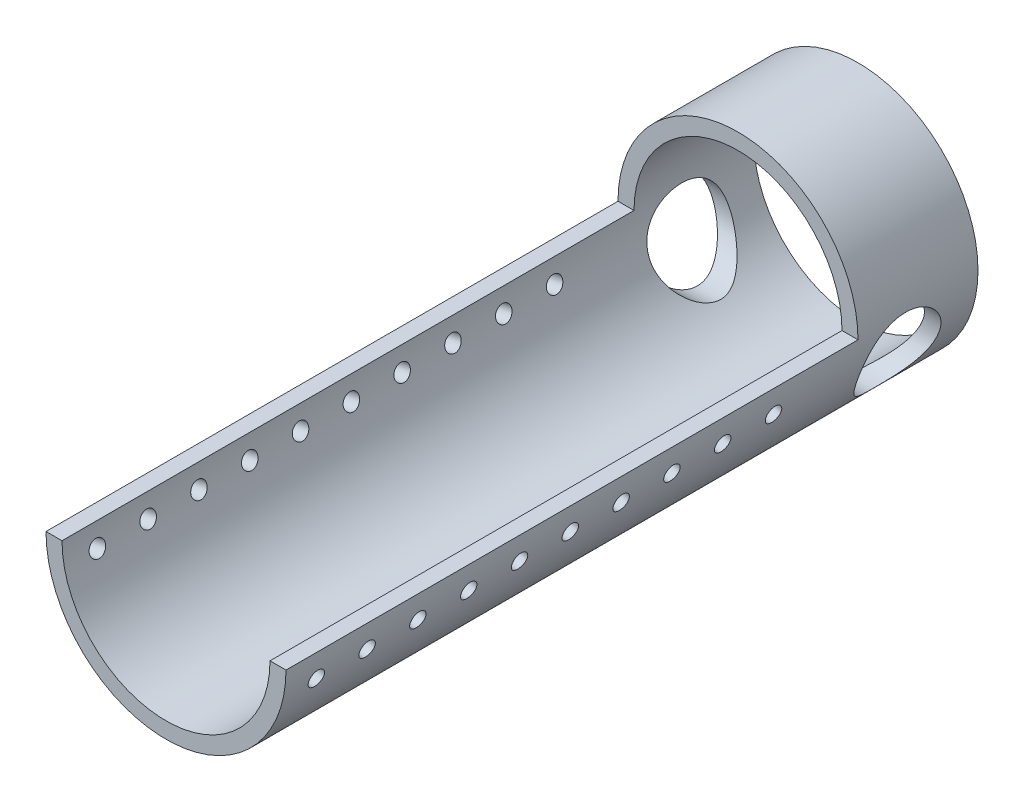
from build123d import *

# Parameters (mm, degrees)
SKETCH1_R               = 30
SKETCH1_R_2             = 26
BOSS_EXTRUDE1_DEPTH     = 86.5
SKETCH3_W               = 60
SKETCH3_H               = 30
CUT_EXTRUDE1_DEPTH      = 143
F_10_32_TAPPED_HOLE2_D  = 4.0386
LPATTERN2_COUNT         = 10
LPATTERN2_PITCH         = 12.7
MIRROR2_COPY_1_D        = 4.0386
MIRROR2_COPY_2_D        = 4.0386
MIRROR2_COPY_3_D        = 4.0386
MIRROR2_COPY_4_D        = 4.0386
MIRROR2_COPY_5_D        = 4.0386
MIRROR2_COPY_6_D        = 4.0386
MIRROR2_COPY_7_D        = 4.0386
MIRROR2_COPY_8_D        = 4.0386
MIRROR2_COPY_9_D        = 4.0386
MIRROR2_COPY_10_D       = 4.0386
CUT_EXTRUDE3_DEPTH      = 97.344434345
CUT_EXTRUDE3_DEPTH_BACK = 97.344434345
SKETCH11_R              = 10.16


with BuildPart() as part:
    # Sketch1 → Boss-Extrude1 (new, symmetric)
    with BuildSketch(Plane.XY):
        Circle(SKETCH1_R)
        Circle(SKETCH1_R_2, mode=Mode.SUBTRACT)
    extrude(amount=BOSS_EXTRUDE1_DEPTH, both=True)

    # Sketch3 → Cut-Extrude1 (cut)
    with BuildSketch(Plane.XY.offset(86.5)):
        with Locations((0, 15)):
            Rectangle(SKETCH3_W, SKETCH3_H)
    extrude(amount=-CUT_EXTRUDE1_DEPTH, mode=Mode.SUBTRACT)

    # #10-32 Tapped Hole2 (through all)
    with Locations(Plane(origin=(29.327958333, -6.314337653, 78.245976981), x_dir=(0.210477921772, 0.977598611111, 0), z_dir=(0.977598611111, -0.210477921772, 0))):
        with Locations((0, 0)):
            f_10_32_tapped_hole2 = Hole(F_10_32_TAPPED_HOLE2_D / 2)

    # LPattern2: #10-32 Tapped Hole2 ×10
    with Locations(*[(0, 0, -i * LPATTERN2_PITCH) for i in range(1, LPATTERN2_COUNT)]):
        add(f_10_32_tapped_hole2, mode=Mode.SUBTRACT)

    # Mirror2 copy 1 (through all)
    with Locations(Plane(origin=(-29.327958333, -6.314337653, 65.545976981), x_dir=(-0.210477921772, 0.977598611111, 0), z_dir=(-0.977598611111, -0.210477921772, 0))):
        with Locations((0, 0)):
            Hole(MIRROR2_COPY_1_D / 2)

    # Mirror2 copy 2 (through all)
    with Locations(Plane(origin=(-29.327958333, -6.314337653, 52.845976981), x_dir=(-0.210477921772, 0.977598611111, 0), z_dir=(-0.977598611111, -0.210477921772, 0))):
        with Locations((0, 0)):
            Hole(MIRROR2_COPY_2_D / 2)

    # Mirror2 copy 3 (through all)
    with Locations(Plane(origin=(-29.327958333, -6.314337653, 40.145976981), x_dir=(-0.210477921772, 0.977598611111, 0), z_dir=(-0.977598611111, -0.210477921772, 0))):
        with Locations((0, 0)):
            Hole(MIRROR2_COPY_3_D / 2)

    # Mirror2 copy 4 (through all)
    with Locations(Plane(origin=(-29.327958333, -6.314337653, 27.445976981), x_dir=(-0.210477921772, 0.977598611111, 0), z_dir=(-0.977598611111, -0.210477921772, 0))):
        with Locations((0, 0)):
            Hole(MIRROR2_COPY_4_D / 2)

    # Mirror2 copy 5 (through all)
    with Locations(Plane(origin=(-29.327958333, -6.314337653, 14.745976981), x_dir=(-0.210477921772, 0.977598611111, 0), z_dir=(-0.977598611111, -0.210477921772, 0))):
        with Locations((0, 0)):
            Hole(MIRROR2_COPY_5_D / 2)

    # Mirror2 copy 6 (through all)
    with Locations(Plane(origin=(-29.327958333, -6.314337653, 2.045976981), x_dir=(-0.210477921772, 0.977598611111, 0), z_dir=(-0.977598611111, -0.210477921772, 0))):
        with Locations((0, 0)):
            Hole(MIRROR2_COPY_6_D / 2)

    # Mirror2 copy 7 (through all)
    with Locations(Plane(origin=(-29.327958333, -6.314337653, -10.654023019), x_dir=(-0.210477921772, 0.977598611111, 0), z_dir=(-0.977598611111, -0.210477921772, 0))):
        with Locations((0, 0)):
            Hole(MIRROR2_COPY_7_D / 2)

    # Mirror2 copy 8 (through all)
    with Locations(Plane(origin=(-29.327958333, -6.314337653, -23.354023019), x_dir=(-0.210477921772, 0.977598611111, 0), z_dir=(-0.977598611111, -0.210477921772, 0))):
        with Locations((0, 0)):
            Hole(MIRROR2_COPY_8_D / 2)

    # Mirror2 copy 9 (through all)
    with Locations(Plane(origin=(-29.327958333, -6.314337653, -36.054023019), x_dir=(-0.210477921772, 0.977598611111, 0), z_dir=(-0.977598611111, -0.210477921772, 0))):
        with Locations((0, 0)):
            Hole(MIRROR2_COPY_9_D / 2)

    # Mirror2 copy 10 (through all)
    with Locations(Plane(origin=(-29.327958333, -6.314337653, 78.245976981), x_dir=(-0.210477921772, 0.977598611111, 0), z_dir=(-0.977598611111, -0.210477921772, 0))):
        with Locations((0, 0)):
            Hole(MIRROR2_COPY_10_D / 2)

    # Sketch11 → Cut-Extrude3 (cut, two sides: drawn at the far end of the back side and taken through both)
    with BuildSketch(Plane(origin=(0, 0, 0), x_dir=(0, 0, -1), z_dir=(1, 0, 0)).offset(-CUT_EXTRUDE3_DEPTH_BACK)):
        with Locations((68.4025, -10.16)):
            Circle(SKETCH11_R)
    extrude(amount=CUT_EXTRUDE3_DEPTH + CUT_EXTRUDE3_DEPTH_BACK, mode=Mode.SUBTRACT)


solid = part.part
